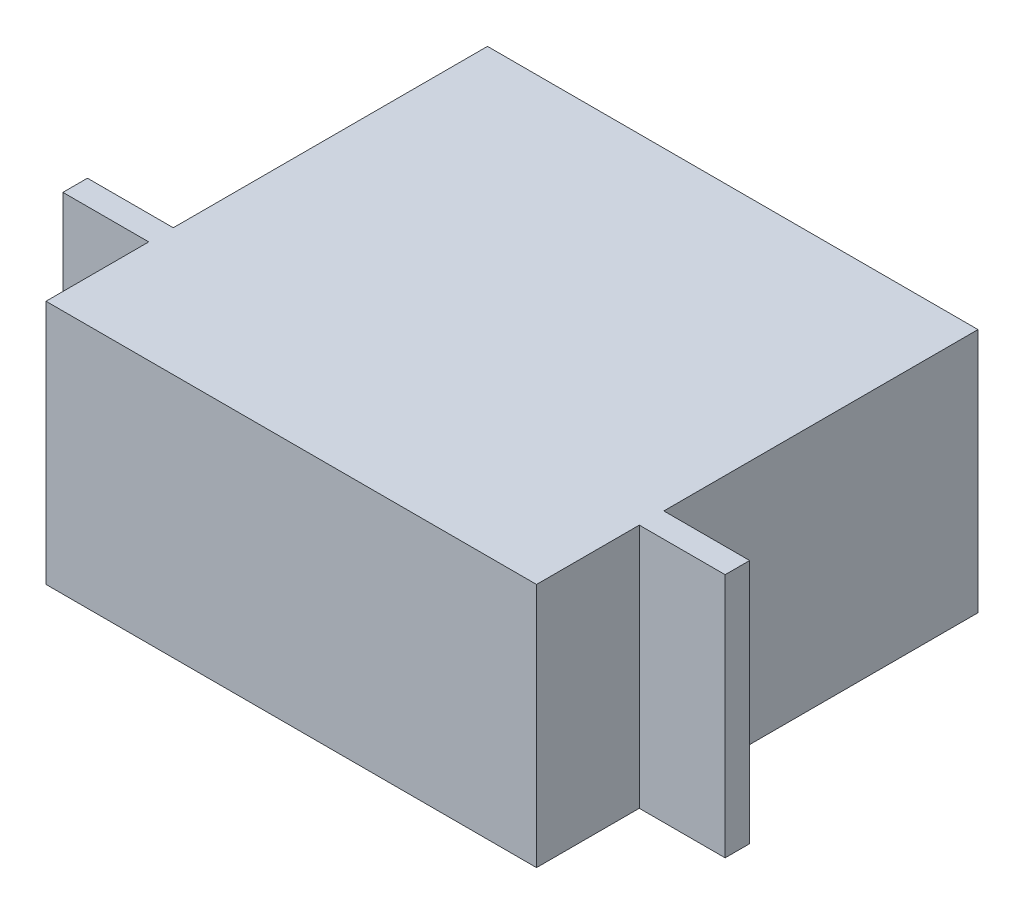
from build123d import *

# Parameters (mm, degrees)
SKETCH1_W           = 40
SKETCH1_H           = 36
BOSS_EXTRUDE1_DEPTH = 10
BOSS_EXTRUDE2_START = 7.62
SKETCH2_W           = 7
SKETCH2_H           = 20
BOSS_EXTRUDE2_DEPTH = 2


with BuildPart() as part:
    # Sketch1 → Boss-Extrude1 (new, symmetric)
    with BuildSketch(Plane(origin=(0, 0, 0), x_dir=(1, 0, 0), z_dir=(0, 1, 0))):
        Rectangle(SKETCH1_W, SKETCH1_H)
    extrude(amount=BOSS_EXTRUDE1_DEPTH, both=True)

    # Sketch2 → Boss-Extrude2 (add)
    with BuildSketch(Plane.XY.offset(BOSS_EXTRUDE2_START)):
        with Locations((-23.5, 0)):
            Rectangle(SKETCH2_W, SKETCH2_H)
        with Locations((23.5, 0)):
            Rectangle(SKETCH2_W, SKETCH2_H)
    extrude(amount=BOSS_EXTRUDE2_DEPTH)


solid = part.part
